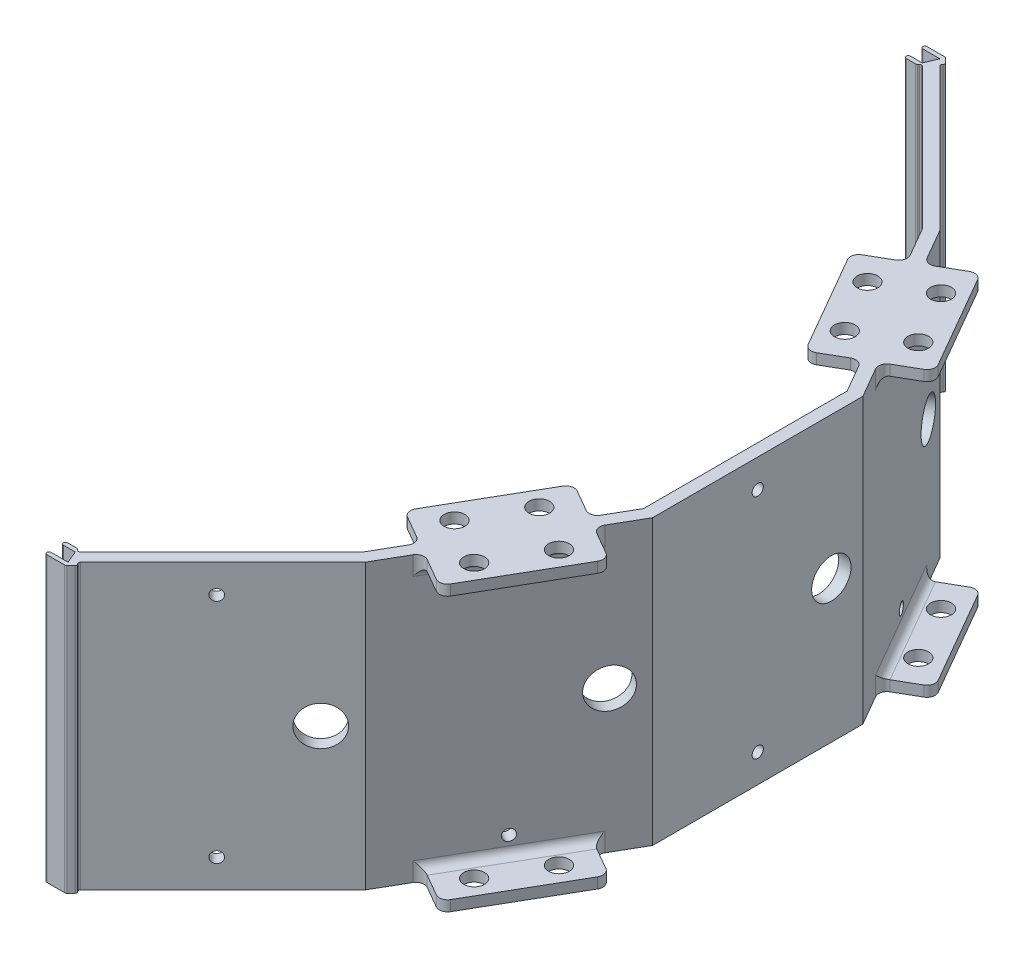
from build123d import *
from build123d.topology import SkipClean

# Parameters (mm, degrees)
SKETCH1_R                             = 2.54
SKETCH1_R_2                           = 6.35
MAINBASEPLATE_DEPTH                   = 3
BASEBOSS_EXTRUDE2_START               = 10.16
SKETCH2_R                             = 6.096
SKETCH2_R_2                           = 2.54
BASEBOSS_EXTRUDE2_DEPTH               = 10.16
BOTTOM_SHELL_WALLSBOSS_EXTRUDE8_DEPTH = 68.58
SKETCH14_R                            = 1.35255
SKETCH14_R_2                          = 4.7625
SHARP1CUT_EXTRUDE4_DEPTH              = 12.7
SKETCH15_R                            = 1.35255
SKETCH15_R_2                          = 4.7625
SHARP2CUT_EXTRUDE5_DEPTH              = 7.62
SKETCH16_R                            = 1.35255
SKETCH16_R_2                          = 4.7625
SHARP3CUT_EXTRUDE6_DEPTH              = 7.62
SKETCH17_R                            = 1.35255
SKETCH17_R_2                          = 4.7625
SHARPCUT_EXTRUDE7_DEPTH               = 7.62
SKETCH18_R                            = 1.35255
SKETCH18_R_2                          = 4.7625
SHARPCUT_EXTRUDE8_DEPTH               = 7.62
FILLET1_R                             = 0.5
SKETCH32_W                            = 571.652981711
SKETCH32_H                            = 274.487273023
CUT_EXTRUDE11_DEPTH                   = 13.16
SKETCH34_R                            = 2.5
BOSS_EXTRUDE8_DEPTH                   = 2.54
BOSS_EXTRUDE9_START                   = -2.54
SKETCH36_R                            = 2.5
BOSS_EXTRUDE9_DEPTH                   = 2.54
FILLET2_R                             = 2
FILLET3_R                             = 2


with BuildPart() as part:
    # Sketch1 → mainbaseplate (new body)
    with BuildSketch(Plane(origin=(0, 0, 0), x_dir=(1, 0, 0), z_dir=(0, 1, 0))):
        with BuildLine():
            Line((-223.52, -111.125), (223.52, -111.125))
            ThreePointArc((223.52, -111.125), (227.112102448, -109.637102448), (228.6, -106.045))
            Line((228.6, -106.045), (228.6, 106.045))
            ThreePointArc((228.6, 106.045), (227.112102448, 109.637102448), (223.52, 111.125))
            Line((223.52, 111.125), (-223.52, 111.125))
            ThreePointArc((-223.52, 111.125), (-227.112102448, 109.637102448), (-228.6, 106.045))
            Line((-228.6, 106.045), (-228.6, -106.045))
            ThreePointArc((-228.6, -106.045), (-227.112102448, -109.637102448), (-223.52, -111.125))
        make_face()
        with Locations(Location((127, 36.5125, 0), (0, 0, 270))):
            Circle(SKETCH1_R, mode=Mode.SUBTRACT)
        with Locations(Location((127, -36.5125, 0), (0, 0, 270))):
            Circle(SKETCH1_R, mode=Mode.SUBTRACT)
        with Locations(Location((-142.24, 36.5125, 0), (0, 0, 270))):
            Circle(SKETCH1_R, mode=Mode.SUBTRACT)
        with Locations(Location((-142.24, -36.5125, 0), (0, 0, 270))):
            Circle(SKETCH1_R, mode=Mode.SUBTRACT)
        with Locations(Location((209.55, 0, 0), (0, 0, 270))):
            Circle(SKETCH1_R_2, mode=Mode.SUBTRACT)
    extrude(amount=MAINBASEPLATE_DEPTH)

    # Sketch2 → BaseBoss-Extrude2 (add)
    # profile 1 of 4: a face of its own
    with SkipClean():  # the faces are left unmerged after this step: merging them gives an invalid solid
        with BuildSketch(Plane.XZ.offset(BASEBOSS_EXTRUDE2_START)):
            with Locations(Location((127, 36.5125, 0), (0, 0, 270))):
                Circle(SKETCH2_R)
            with Locations(Location((127, 36.5125, 0), (0, 0, 270))):
                Circle(SKETCH2_R_2, mode=Mode.SUBTRACT)
        # profile 2 of 4: a face of its own
        with BuildSketch(Plane.XZ.offset(BASEBOSS_EXTRUDE2_START)):
            with Locations(Location((127, -36.5125, 0), (0, 0, 270))):
                Circle(SKETCH2_R)
            with Locations(Location((127, -36.5125, 0), (0, 0, 270))):
                Circle(SKETCH2_R_2, mode=Mode.SUBTRACT)
        # profile 3 of 4: a face of its own
        with BuildSketch(Plane.XZ.offset(BASEBOSS_EXTRUDE2_START)):
            with Locations(Location((-142.24, -36.5125, 0), (0, 0, 270))):
                Circle(SKETCH2_R)
            with Locations(Location((-142.24, -36.5125, 0), (0, 0, 270))):
                Circle(SKETCH2_R_2, mode=Mode.SUBTRACT)
        # profile 4 of 4: a face of its own
        with BuildSketch(Plane.XZ.offset(BASEBOSS_EXTRUDE2_START)):
            with Locations(Location((-142.24, 36.5125, 0), (0, 0, 270))):
                Circle(SKETCH2_R)
            with Locations(Location((-142.24, 36.5125, 0), (0, 0, 270))):
                Circle(SKETCH2_R_2, mode=Mode.SUBTRACT)
        extrude(amount=-BASEBOSS_EXTRUDE2_DEPTH)

    # Sketch13 → Bottom Shell WallsBoss-Extrude8 (add)
    with SkipClean():  # the faces are left unmerged after this step: merging them gives an invalid solid
        with BuildSketch(Plane(origin=(0, 3, 0), x_dir=(1, 0, 0), z_dir=(0, 1, 0))):
            Polygon((198.12, -25.4), (198.12, 25.4), (172.72, 69.394090512), (137.970548391, 104.143542121), (138.677655172, 104.850648902), (137.213189078, 106.315114997), (132.193713287, 106.315114997), (132.193713287, 105.315114997), (136.798975516, 105.315114997), (135.556334829, 102.315114997), (132.193713287, 102.315114997), (132.193713287, 101.315114997), (135.142121266, 101.315114997), (135.849228047, 102.022221778), (170.319402535, 67.55204729), (195.12, 24.596152423), (195.12, -24.596152423), (170.319402535, -67.55204729), (135.849228047, -102.022221778), (135.142121266, -101.315114997), (132.193713287, -101.315114997), (132.193713287, -102.315114997), (135.556334829, -102.315114997), (136.798975516, -105.315114997), (132.193713287, -105.315114997), (132.193713287, -106.315114997), (137.213189078, -106.315114997), (138.677655172, -104.850648902), (137.970548391, -104.143542121), (172.72, -69.394090512), align=None)
        extrude(amount=BOTTOM_SHELL_WALLSBOSS_EXTRUDE8_DEPTH)

    # Sketch14 → Sharp1Cut-Extrude4 (cut)
    with SkipClean():  # the faces are left unmerged after this step: merging them gives an invalid solid
        with BuildSketch(Plane(origin=(121.057045256, 0, -121.057045256), x_dir=(-0.7071067811865495, 0, -0.7071067811865457), z_dir=(0.7071067811865457, 0, -0.7071067811865495))):
            with Locations((-47.662451271, 64.722)):
                Circle(SKETCH14_R)
            with Locations((-47.662451271, 9.858)):
                Circle(SKETCH14_R)
            with Locations((-29.882451271, 37.29)):
                Circle(SKETCH14_R_2)
        extrude(amount=-SHARP1CUT_EXTRUDE4_DEPTH, mode=Mode.SUBTRACT)

    # Sketch15 → Sharp2Cut-Extrude5 (cut)
    with SkipClean():  # the faces are left unmerged after this step: merging them gives an invalid solid
        with BuildSketch(Plane(origin=(159.588522628, 0, -92.138476499), x_dir=(-0.5000000000000009, 0, -0.8660254037844383), z_dir=(0.8660254037844382, 0, -0.5000000000000008))):
            with Locations((-51.662954744, 64.722)):
                Circle(SKETCH15_R)
            with Locations((-51.662954744, 9.858)):
                Circle(SKETCH15_R)
            with Locations((-33.882954744, 37.29)):
                Circle(SKETCH15_R_2)
        extrude(amount=-SHARP2CUT_EXTRUDE5_DEPTH, mode=Mode.SUBTRACT)

    # Sketch16 → Sharp3Cut-Extrude6 (cut)
    with SkipClean():  # the faces are left unmerged after this step: merging them gives an invalid solid
        with BuildSketch(Plane(origin=(198.12, 0, 0), x_dir=(0, 0, -1), z_dir=(1, 0, 0))):
            with Locations((0, 64.722)):
                Circle(SKETCH16_R)
            with Locations((0, 9.858)):
                Circle(SKETCH16_R)
            with Locations((17.78, 37.29)):
                Circle(SKETCH16_R_2)
        extrude(amount=-SHARP3CUT_EXTRUDE6_DEPTH, mode=Mode.SUBTRACT)

    # Sketch17 → SharpCut-Extrude7 (cut)
    with SkipClean():  # the faces are left unmerged after this step: merging them gives an invalid solid
        with BuildSketch(Plane(origin=(159.588522628, 0, 92.138476499), x_dir=(0.5000000000000009, 0, -0.8660254037844383), z_dir=(0.8660254037844382, 0, 0.5000000000000008))):
            with Locations((51.662954744, 64.722)):
                Circle(SKETCH17_R)
            with Locations((51.662954744, 9.858)):
                Circle(SKETCH17_R)
            with Locations((69.442954744, 37.29)):
                Circle(SKETCH17_R_2)
        extrude(amount=-SHARPCUT_EXTRUDE7_DEPTH, mode=Mode.SUBTRACT)

    # Sketch18 → SharpCut-Extrude8 (cut)
    with SkipClean():  # the faces are left unmerged after this step: merging them gives an invalid solid
        with BuildSketch(Plane(origin=(121.057045256, 0, 121.057045256), x_dir=(0.7071067811865492, 0, -0.7071067811865458), z_dir=(0.7071067811865458, 0, 0.7071067811865492))):
            with Locations((47.662451271, 64.722)):
                Circle(SKETCH18_R)
            with Locations((47.662451271, 9.858)):
                Circle(SKETCH18_R)
            with Locations((65.442451271, 37.29)):
                Circle(SKETCH18_R_2)
        extrude(amount=-SHARPCUT_EXTRUDE8_DEPTH, mode=Mode.SUBTRACT)

    # Fillet1
    fillet1_edges = [part.edges().sort_by_distance(p)[0] for p in [
        (138.677655172, 37.29, 104.850648902),
        (137.970548391, 37.29, 104.143542121),
        (138.677655172, 37.29, -104.850648902),
        (137.970548391, 37.29, -104.143542121),
        (132.193713287, 37.29, 101.315114997),
        (132.193713287, 37.29, 102.315114997),
        (135.142121266, 37.29, 101.315114997),
        (135.849228047, 37.29, 102.022221778),
        (132.193713287, 37.29, 105.315114997),
        (132.193713287, 37.29, 106.315114997),
        (137.213189078, 37.29, 106.315114997),
        (135.142121266, 37.29, -101.315114997),
        (135.849228047, 37.29, -102.022221778),
        (132.193713287, 37.29, -102.315114997),
        (132.193713287, 37.29, -101.315114997),
        (132.193713287, 37.29, -106.315114997),
        (132.193713287, 37.29, -105.315114997),
        (137.213189078, 37.29, -106.315114997),
    ]]
    fillet(fillet1_edges, radius=FILLET1_R - 0.0001)  # a hair under: the kernel refuses the full size

    # Sketch32 → Cut-Extrude11 (cut)
    with BuildSketch(Plane.XZ.offset(10.16)):
        with Locations((-31.280600914, 3.128060092)):
            Rectangle(SKETCH32_W, SKETCH32_H)
    extrude(amount=-CUT_EXTRUDE11_DEPTH, mode=Mode.SUBTRACT)

    # Sketch34 → Boss-Extrude8 (add)
    # profile 1 of 4: a face of its own
    with BuildSketch(Plane.XZ.offset(-3)):
        Polygon((186.580254038, -65.387426313), (201.580254038, -39.406664199), (192.92, -34.406664199), (177.92, -60.387426313), align=None)
        with Locations(Location((186.000127019, -56.392235785, 0), (0, 0, 270))):
            Circle(SKETCH34_R, mode=Mode.SUBTRACT)
        with Locations(Location((193.500127019, -43.401854728, 0), (0, 0, 270))):
            Circle(SKETCH34_R, mode=Mode.SUBTRACT)
    # profile 2 of 4: a face of its own
    with BuildSketch(Plane.XZ.offset(-3)):
        Polygon((175.321923789, -58.887426313), (190.321923789, -32.906664199), (181.661669751, -27.906664199), (166.661669751, -53.887426313), align=None)
        with Locations(Location((174.74179677, -49.892235785, 0), (0, 0, 270))):
            Circle(SKETCH34_R, mode=Mode.SUBTRACT)
        with Locations(Location((182.24179677, -36.901854728, 0), (0, 0, 270))):
            Circle(SKETCH34_R, mode=Mode.SUBTRACT)
    # profile 3 of 4: a face of its own
    with BuildSketch(Plane.XZ.offset(-3)):
        Polygon((181.661669751, 27.906664199), (190.321923789, 32.906664199), (175.321923789, 58.887426313), (166.661669751, 53.887426313), align=None)
        with Locations(Location((174.74179677, 49.892235785, 0), (0, 0, 270))):
            Circle(SKETCH34_R, mode=Mode.SUBTRACT)
        with Locations(Location((182.24179677, 36.901854728, 0), (0, 0, 270))):
            Circle(SKETCH34_R, mode=Mode.SUBTRACT)
    # profile 4 of 4: a face of its own
    with BuildSketch(Plane.XZ.offset(-3)):
        Polygon((186.580254038, 65.387426313), (177.92, 60.387426313), (192.92, 34.406664199), (201.580254038, 39.406664199), align=None)
        with Locations(Location((186.000127019, 56.392235785, 0), (0, 0, 270))):
            Circle(SKETCH34_R, mode=Mode.SUBTRACT)
        with Locations(Location((193.500127019, 43.401854728, 0), (0, 0, 270))):
            Circle(SKETCH34_R, mode=Mode.SUBTRACT)
    extrude(amount=-BOSS_EXTRUDE8_DEPTH)

    # Sketch36 → Boss-Extrude9 (add)
    # profile 1 of 6: a face of its own
    with BuildSketch(Plane(origin=(0, 71.58, 0), x_dir=(1, 0, 0), z_dir=(0, 1, 0)).offset(BOSS_EXTRUDE9_START)):
        Polygon((186.580254038, 65.387426313), (177.92, 60.387426313), (192.92, 34.406664199), (201.580254038, 39.406664199), align=None)
        with Locations(Location((186.000127019, 56.392235785, 0), (0, 0, 90))):
            Circle(SKETCH36_R, mode=Mode.SUBTRACT)
        with Locations(Location((193.500127019, 43.401854728, 0), (0, 0, 90))):
            Circle(SKETCH36_R, mode=Mode.SUBTRACT)
    # profile 2 of 6: a face of its own
    with BuildSketch(Plane(origin=(0, 71.58, 0), x_dir=(1, 0, 0), z_dir=(0, 1, 0)).offset(BOSS_EXTRUDE9_START)):
        Polygon((175.321923789, 58.887426313), (166.661669751, 53.887426313), (181.661669751, 27.906664199), (190.321923789, 32.906664199), align=None)
        with Locations(Location((174.74179677, 49.892235785, 0), (0, 0, 90))):
            Circle(SKETCH36_R, mode=Mode.SUBTRACT)
        with Locations(Location((182.24179677, 36.901854728, 0), (0, 0, 90))):
            Circle(SKETCH36_R, mode=Mode.SUBTRACT)
    # profile 3 of 6: a face of its own
    with BuildSketch(Plane(origin=(0, 71.58, 0), x_dir=(1, 0, 0), z_dir=(0, 1, 0)).offset(BOSS_EXTRUDE9_START)):
        Polygon((166.661669751, -53.887426313), (175.321923789, -58.887426313), (190.321923789, -32.906664199), (181.661669751, -27.906664199), align=None)
        with Locations(Location((174.74179677, -49.892235785, 0), (0, 0, 90))):
            Circle(SKETCH36_R, mode=Mode.SUBTRACT)
        with Locations(Location((182.24179677, -36.901854728, 0), (0, 0, 90))):
            Circle(SKETCH36_R, mode=Mode.SUBTRACT)
    # profile 4 of 6: a face of its own
    with BuildSketch(Plane(origin=(0, 71.58, 0), x_dir=(1, 0, 0), z_dir=(0, 1, 0)).offset(BOSS_EXTRUDE9_START)):
        Polygon((192.92, -34.406664199), (177.92, -60.387426313), (186.580254038, -65.387426313), (201.580254038, -39.406664199), align=None)
        with Locations(Location((186.000127019, -56.392235785, 0), (0, 0, 90))):
            Circle(SKETCH36_R, mode=Mode.SUBTRACT)
        with Locations(Location((193.500127019, -43.401854728, 0), (0, 0, 90))):
            Circle(SKETCH36_R, mode=Mode.SUBTRACT)
    # profile 5 of 6: a face of its own
    with BuildSketch(Plane(origin=(0, 71.58, 0), x_dir=(1, 0, 0), z_dir=(0, 1, 0)).offset(BOSS_EXTRUDE9_START)):
        Polygon((175.321923789, -58.887426313), (177.92, -60.387426313), (192.92, -34.406664199), (190.321923789, -32.906664199), align=None)
    # profile 6 of 6: a face of its own
    with BuildSketch(Plane(origin=(0, 71.58, 0), x_dir=(1, 0, 0), z_dir=(0, 1, 0)).offset(BOSS_EXTRUDE9_START)):
        Polygon((177.92, 60.387426313), (175.321923789, 58.887426313), (190.321923789, 32.906664199), (192.92, 34.406664199), align=None)
    extrude(amount=BOSS_EXTRUDE9_DEPTH)

    # Fillet2
    fillet2_edges = [part.edges().sort_by_distance(p)[0] for p in [
        (177.92, 4.27, -60.387426313),
        (192.92, 4.27, -34.406664199),
        (201.580254038, 4.27, -39.406664199),
        (186.580254038, 4.27, -65.387426313),
        (185.42, 5.54, -47.397045256),
        (181.661669751, 4.27, -27.906664199),
        (190.321923789, 4.27, -32.906664199),
        (175.321923789, 4.27, -58.887426313),
        (166.661669751, 4.27, -53.887426313),
        (182.821923789, 5.54, -45.897045256),
        (190.321923789, 4.27, 32.906664199),
        (181.661669751, 4.27, 27.906664199),
        (166.661669751, 4.27, 53.887426313),
        (175.321923789, 4.27, 58.887426313),
        (182.821923789, 5.54, 45.897045256),
        (201.580254038, 4.27, 39.406664199),
        (192.92, 4.27, 34.406664199),
        (177.92, 4.27, 60.387426313),
        (186.580254038, 4.27, 65.387426313),
        (185.42, 5.54, 47.397045256),
    ]]
    fillet(fillet2_edges, radius=FILLET2_R)

    # Fillet3
    fillet3_edges = [part.edges().sort_by_distance(p)[0] for p in [
        (182.821923789, 69.04, 45.897045256),
        (185.42, 69.04, 47.397045256),
        (190.321923789, 70.31, 32.906664199),
        (181.661669751, 70.31, 27.906664199),
        (175.321923789, 70.31, 58.887426313),
        (166.661669751, 70.31, 53.887426313),
        (192.92, 70.31, 34.406664199),
        (201.580254038, 70.31, 39.406664199),
        (177.92, 70.31, 60.387426313),
        (186.580254038, 70.31, 65.387426313),
        (185.42, 69.04, -47.397045256),
        (182.821923789, 69.04, -45.897045256),
        (175.321923789, 70.31, -58.887426313),
        (177.92, 70.31, -60.387426313),
        (190.321923789, 70.31, -32.906664199),
        (192.92, 70.31, -34.406664199),
        (201.580254038, 70.31, -39.406664199),
        (166.661669751, 70.31, -53.887426313),
        (186.580254038, 70.31, -65.387426313),
        (181.661669751, 70.31, -27.906664199),
    ]]
    fillet(fillet3_edges, radius=FILLET3_R)


solid = part.part
